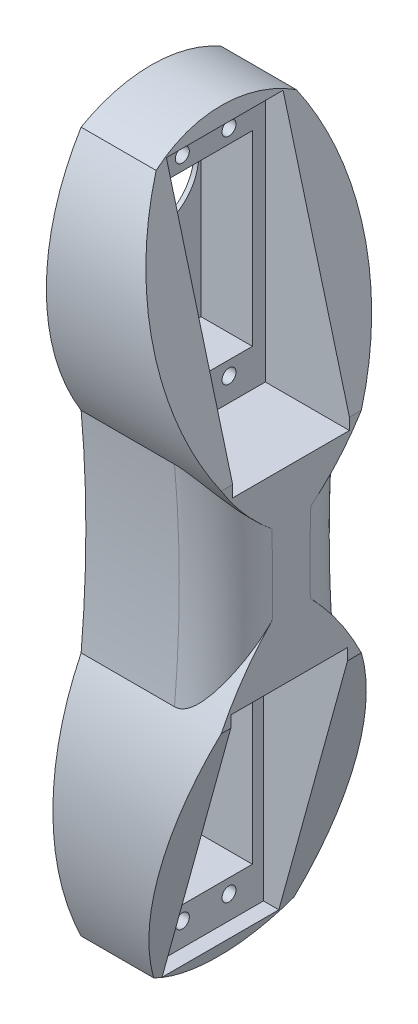
from build123d import *

# Parameters (mm, degrees)
BOSS_EXTRUDE1_DEPTH     = 30
SKETCH2_R               = 1.5000000000000049
SKETCH2_R_2             = 1.500000000000013
SKETCH2_R_3             = 1.5000000000000009
SKETCH2_R_4             = 1.5000000000000004
CUT_EXTRUDE1_DEPTH      = 29
CUT_EXTRUDE2_DEPTH      = 18
CUT_EXTRUDE3_DEPTH      = 40
CUT_EXTRUDE3_DEPTH_BACK = 40
SKETCH5_R               = 9.5
CUT_EXTRUDE4_DEPTH      = 40
FILLET1_R               = 10
FILLET2_R               = 10


with BuildPart() as part:
    # Sketch1 → Boss-Extrude1 (new body)
    with BuildSketch(Plane(origin=(0, 0, 0), x_dir=(0, 0, -1), z_dir=(1, 0, 0))):
        with BuildLine():
            ThreePointArc((14.999999999999988, 22.48862564156887), (13.986468943100135, -3.598e-14), (15, -22.488625641568866))
            ThreePointArc((15, -22.488625641568866), (21.049662737410323, -48.744312820784444), (15.000000000000004, -75.00000000000001))
            ThreePointArc((15.000000000000004, -75.00000000000001), (4.72e-15, -79.01923788646685), (-14.999999999999996, -75.00000000000001))
            ThreePointArc((-14.999999999999996, -75.00000000000001), (-21.049662737410294, -48.74431282078444), (-15.00000000000001, -22.488625641568866))
            ThreePointArc((-15.00000000000001, -22.488625641568866), (-13.986468943100135, 1.189e-14), (-15.00000000000001, 22.488625641568895))
            ThreePointArc((-15.00000000000001, 22.488625641568895), (-22.448397318700515, 48.74431282078445), (-15.000000000000007, 74.99999999999999))
            ThreePointArc((-15.000000000000007, 74.99999999999999), (-1.35e-15, 79.01923788646687), (14.99999999999999, 74.99999999999999))
            ThreePointArc((14.99999999999999, 74.99999999999999), (22.448397318700543, 48.744312820784415), (14.999999999999988, 22.48862564156887))
        make_face()
    extrude(amount=BOSS_EXTRUDE1_DEPTH)

    # Sketch2 → Cut-Extrude1 (cut)
    with BuildSketch(Plane(origin=(30, 0, 0), x_dir=(0, 0, -1), z_dir=(1, 0, 0))):
        with Locations((4.6684040574518, 71.01923788646675)):
            Circle(SKETCH2_R)
        with Locations((-5.331595942548199, 71.01923788646673)):
            Circle(SKETCH2_R_2)
        with Locations((4.6684040574518, 25.01923788646677)):
            Circle(SKETCH2_R_3)
        with Locations((-5.331595942548199, 24.86968442746252)):
            Circle(SKETCH2_R_4)
        with Locations((4.6684040574518, -25.019237886466854)):
            Circle(SKETCH2_R_3)
        with Locations((-5.331595942548199, -25.01923788646685)):
            Circle(SKETCH2_R_3)
        with Locations((4.6684040574518, -71.01923788646685)):
            Circle(SKETCH2_R_3)
        with Locations((-5.331595942548199, -71.01923788646685)):
            Circle(SKETCH2_R_3)
        Polygon((-10.3315959425482, 68.01923788646677), (9.6684040574518, 68.01923788646677), (9.668404057451806, 28.01923788646677), (-10.331595942548194, 28.019237886466765), align=None)
        Polygon((-10.331595942548196, -28.019237886466858), (9.668404057451804, -28.019237886466854), (9.66840405745181, -68.01923788646685), (-10.33159594254819, -68.01923788646685), align=None)
    extrude(amount=-CUT_EXTRUDE1_DEPTH, mode=Mode.SUBTRACT)

    # Sketch3 → Cut-Extrude2 (cut)
    with BuildSketch(Plane(origin=(30, 0, 0), x_dir=(0, 0, -1), z_dir=(1, 0, 0))):
        Polygon((-12.551602681299467, 76.01923788646684), (12.44839731870053, 76.01923788646684), (12.448397318700541, 20.019237886466833), (-12.55160268129946, 20.019237886466833), align=None)
        Polygon((-12.950337262589732, -20.01923788646686), (12.04966273741027, -20.01923788646686), (12.049662737410275, -76.01923788646687), (-12.950337262589725, -76.01923788646687), align=None)
    extrude(amount=-CUT_EXTRUDE2_DEPTH, mode=Mode.SUBTRACT)

    # Sketch4 → Cut-Extrude3 (cut, two sides: drawn at the far end of the back side and taken through both)
    with BuildSketch(Plane.XY.offset(-CUT_EXTRUDE3_DEPTH_BACK)):
        Polygon((15, 79.01923788646681), (30, 22.48862564156887), (30, -22.488625641568873), (14.279552603766648, -79.68148202341017), (43.09744845310124, -79.68148202341017), (43.09744845310124, 80.44995924605905), align=None)
    extrude(amount=CUT_EXTRUDE3_DEPTH + CUT_EXTRUDE3_DEPTH_BACK, mode=Mode.SUBTRACT)

    # Sketch5 → Cut-Extrude4 (cut)
    with BuildSketch(Plane(origin=(0, 0, 0), x_dir=(0, 0, -1), z_dir=(1, 0, 0))):
        with Locations((-0.33159594254819796, 58.01923788646677)):
            Circle(SKETCH5_R)
        with Locations((-0.331595942548191, -58.019237886466854)):
            Circle(SKETCH5_R)
    extrude(amount=CUT_EXTRUDE4_DEPTH, mode=Mode.SUBTRACT)

    # Fillet1
    # the kernel refuses this fillet: 10 mm, written as the material it takes off along each edge
    with BuildSketch(Plane(origin=(30, 7.017e-14, -263.9864689431014), x_dir=(0, 0.1889343030386976, 0.9819897296485751), z_dir=(0, 0.9819897296485751, -0.1889343030386976))) as fillet1_piece_1_section:
        with BuildLine():
            CenterArc((250.00000000000125 + FILLET1_R, -FILLET1_R), FILLET1_R, 90, 90)
            Line((250.00000000000125 + FILLET1_R, 0), (250.00000000000125, 0))
            Line((250.00000000000125, 0), (250.00000000000125, -FILLET1_R))
        make_face()
    fillet1_piece_1 = revolve(axis=Axis((30, 7.017e-14, -263.9864689431014), (1, 0, 0)), revolution_arc=21.781195760755132, mode=Mode.PRIVATE)
    fillet1_piece_1 = fillet1_piece_1 - Plane(origin=(27.494567227966037, 48.74431282078443, 27.551602681299116), x_dir=(0, 0.5251137435843147, -0.851032053625988), z_dir=(-1, 0, 0)) * Cylinder(49.99999999999966, 1041, mode=Mode.PRIVATE)
    fillet1_piece_1 = fillet1_piece_1 - Plane(origin=(27.494567227966037, -48.744312820784444, 38.95033726258946), x_dir=(0, 0.4375947863202612, -0.8991722877098276), z_dir=(-1, 0, 0)) * Cylinder(59.99999999999978, 1041, mode=Mode.PRIVATE)
    add(fillet1_piece_1, mode=Mode.SUBTRACT)

    # Fillet2
    fillet2_edges = [part.edges().sort_by_distance(p)[0] for p in [
        (30, 1.066e-14, 13.986468943100135),
    ]]
    fillet(fillet2_edges, radius=FILLET2_R)


solid = part.part
